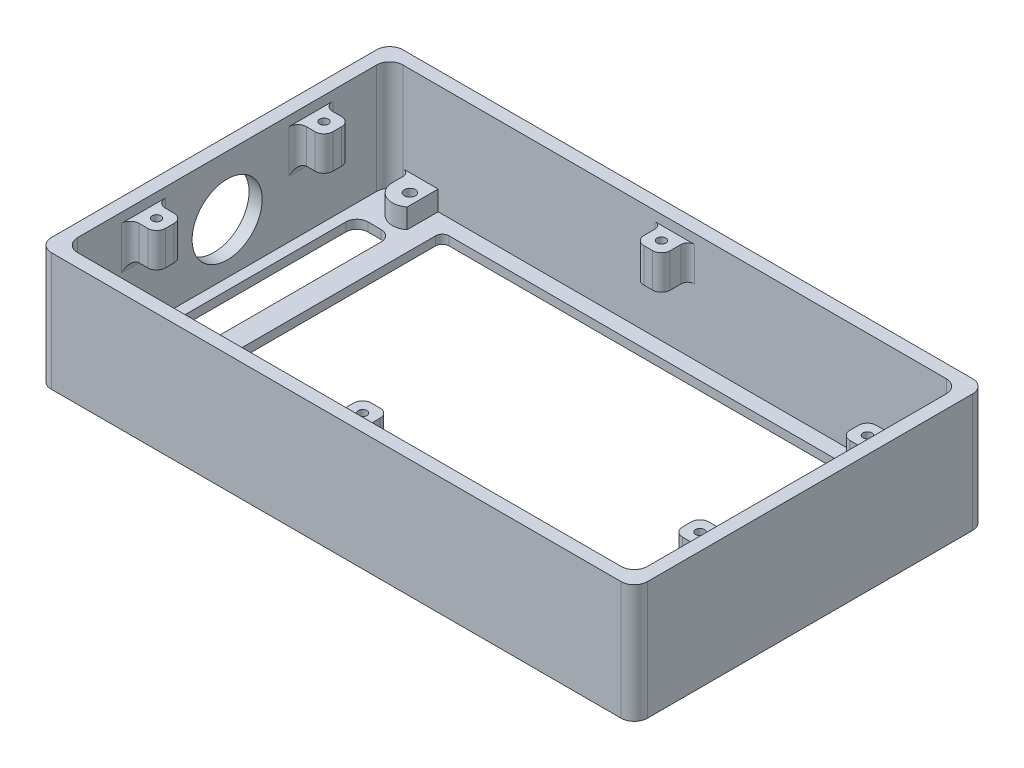
from build123d import *

# Parameters (mm, degrees)
BOSS_EXTRUDE2_DEPTH            = 2
SKETCH3_R                      = 1
SKETCH3_W                      = 99
SKETCH3_H                      = 58
CUT_EXTRUDE1_DEPTH             = 2
SKETCH5_R                      = 4
SKETCH5_R_2                    = 1.25
BOSS_EXTRUDE4_DEPTH            = 4.5
BOSS_EXTRUDE5_DEPTH            = 25
BOSS_EXTRUDE6_START            = -2
SKETCH7_R                      = 1
BOSS_EXTRUDE6_DEPTH            = 2
BOSS_EXTRUDE8_DEPTH            = 10
CUT_EXTRUDE2_START             = -2.2
CUT_EXTRUDE2_DEPTH             = 2.2
FILLET2_R                      = 1.5
FILLET3_R                      = 2
BOSS_EXTRUDE11_START           = -4.5
BOSS_EXTRUDE11_DEPTH           = 4.5
BOSS_EXTRUDE12_START           = -4.5
BOSS_EXTRUDE12_DEPTH           = 4.5
CUT_EXTRUDE3_REACH             = 160.697
SKETCH16_R                     = 8
CUT_EXTRUDE3_DIRECTION_2_DEPTH = 159.697321969
SKETCH17_R                     = 1
BOSS_EXTRUDE14_DEPTH           = 10
SKETCH20_R                     = 1
BOSS_EXTRUDE15_DEPTH           = 10
FILLET6_R                      = 1.5
SKETCH22_W                     = 21.854456245
SKETCH22_H                     = 74.2
CUT_EXTRUDE4_DEPTH             = 2.2
CUT_EXTRUDE5_DEPTH             = 156.800641847
SKETCH28_W                     = 3.653632657
SKETCH28_H                     = 8
SKETCH28_H_2                   = 9.504640586
CUT_EXTRUDE6_DEPTH             = 4.5


with BuildPart() as part:
    # Sketch2 → Boss-Extrude2 (new body)
    with BuildSketch(Plane(origin=(0, 0, 0), x_dir=(1, 0, 0), z_dir=(0, 1, 0))):
        with BuildLine():
            Line((0, 77.2), (130, 77.2))
            ThreePointArc((130, 77.2), (132.121320344, 76.321320344), (133, 74.2))
            Line((133, 74.2), (133, 0))
            ThreePointArc((133, 0), (132.121320344, -2.121320344), (130, -3))
            Line((130, -3), (0, -3))
            ThreePointArc((0, -3), (-2.121320344, -2.121320344), (-3, 0))
            Line((-3, 0), (-3, 74.2))
            ThreePointArc((-3, 74.2), (-2.121320344, 76.321320344), (0, 77.2))
        make_face()
    extrude(amount=BOSS_EXTRUDE2_DEPTH)

    # Sketch3 → Cut-Extrude1 (cut)
    with BuildSketch(Plane(origin=(0, 2, 0), x_dir=(1, 0, 0), z_dir=(0, 1, 0))):
        with Locations(Location((8.55, 70.25, 0), (0, 0, 270))):
            Circle(SKETCH3_R)
        with Locations(Location((8.55, 8.15, 0), (0, 0, 270))):
            Circle(SKETCH3_R)
        with Locations(Location((121.15, 8.15, 0), (0, 0, 270))):
            Circle(SKETCH3_R)
        with Locations(Location((121.15, 70.25, 0), (0, 0, 270))):
            Circle(SKETCH3_R)
        with Locations((65, 41.7)):
            Rectangle(SKETCH3_W, SKETCH3_H)
    extrude(amount=-CUT_EXTRUDE1_DEPTH, mode=Mode.SUBTRACT)

    # Sketch5 → Boss-Extrude4 (add)
    # profile 1 of 4: a face of its own
    with BuildSketch(Plane(origin=(0, 2, 0), x_dir=(1, 0, 0), z_dir=(0, 1, 0))):
        with Locations(Location((8.55, 70.25, 0), (0, 0, 270))):
            Circle(SKETCH5_R)
        with Locations(Location((8.55, 70.25, 0), (0, 0, 270))):
            Circle(SKETCH5_R_2, mode=Mode.SUBTRACT)
    # profile 2 of 4: a face of its own
    with BuildSketch(Plane(origin=(0, 2, 0), x_dir=(1, 0, 0), z_dir=(0, 1, 0))):
        with Locations(Location((8.55, 8.15, 0), (0, 0, 270))):
            Circle(SKETCH5_R)
        with Locations(Location((8.55, 8.15, 0), (0, 0, 270))):
            Circle(SKETCH5_R_2, mode=Mode.SUBTRACT)
    # profile 3 of 4: a face of its own
    with BuildSketch(Plane(origin=(0, 2, 0), x_dir=(1, 0, 0), z_dir=(0, 1, 0))):
        with Locations(Location((121.15, 8.15, 0), (0, 0, 270))):
            Circle(SKETCH5_R)
        with Locations(Location((121.15, 8.15, 0), (0, 0, 270))):
            Circle(SKETCH5_R_2, mode=Mode.SUBTRACT)
    # profile 4 of 4: a face of its own
    with BuildSketch(Plane(origin=(0, 2, 0), x_dir=(1, 0, 0), z_dir=(0, 1, 0))):
        with Locations(Location((121.15, 70.25, 0), (0, 0, 270))):
            Circle(SKETCH5_R)
        with Locations(Location((121.15, 70.25, 0), (0, 0, 270))):
            Circle(SKETCH5_R_2, mode=Mode.SUBTRACT)
    extrude(amount=BOSS_EXTRUDE4_DEPTH)

    # Sketch6 → Boss-Extrude5 (add)
    with BuildSketch(Plane(origin=(0, 2, 0), x_dir=(1, 0, 0), z_dir=(0, 1, 0))):
        with BuildLine():
            Line((0, 77.2), (130, 77.2))
            ThreePointArc((130, 77.2), (132.121320344, 76.321320344), (133, 74.2))
            Line((133, 74.2), (133, 0))
            ThreePointArc((133, 0), (132.121320344, -2.121320344), (130, -3))
            Line((130, -3), (0, -3))
            ThreePointArc((0, -3), (-2.121320344, -2.121320344), (-3, 0))
            Line((-3, 0), (-3, 74.2))
            ThreePointArc((-3, 74.2), (-2.121320344, 76.321320344), (0, 77.2))
        make_face()
        with BuildLine():
            Line((3, 74.2), (127, 74.2))
            ThreePointArc((127, 74.2), (129.121320344, 73.321320344), (130, 71.2))
            Line((130, 71.2), (130, 3))
            ThreePointArc((130, 3), (129.121320344, 0.878679656), (127, 0))
            Line((127, 0), (3, 0))
            ThreePointArc((3, 0), (0.878679656, 0.878679656), (0, 3))
            Line((0, 3), (0, 71.2))
            ThreePointArc((0, 71.2), (0.878679656, 73.321320344), (3, 74.2))
        make_face(mode=Mode.SUBTRACT)
    extrude(amount=BOSS_EXTRUDE5_DEPTH)

    # Sketch7 → Boss-Extrude6 (add)
    with BuildSketch(Plane.XZ.offset(BOSS_EXTRUDE6_START)):
        with Locations((8.55, -8.15)):
            Circle(SKETCH7_R)
        with Locations((8.55, -70.25)):
            Circle(SKETCH7_R)
        with Locations((121.15, -70.25)):
            Circle(SKETCH7_R)
        with Locations((121.15, -8.15)):
            Circle(SKETCH7_R)
    extrude(amount=BOSS_EXTRUDE6_DEPTH)

    # Sketch10 → Boss-Extrude8 (add)
    with BuildSketch(Plane(origin=(0, 27, 0), x_dir=(1, 0, 0), z_dir=(0, 1, 0))):
        with BuildLine():
            Line((4, 59.2), (0, 59.2))
            Line((0, 59.2), (2.292893219, 56.907106781))
            ThreePointArc((2.292893219, 56.907106781), (3.382683432, 57.123879533), (4, 56.2))
            ThreePointArc((4, 56.2), (3.923879533, 55.817316568), (3.707106781, 55.492893219))
            Line((3.707106781, 55.492893219), (5.414213562, 53.785786438))
            ThreePointArc((5.414213562, 53.785786438), (5.847759065, 54.434633135), (6, 55.2))
            Line((6, 55.2), (6, 57.2))
            ThreePointArc((6, 57.2), (5.414213562, 58.614213562), (4, 59.2))
        make_face()
        with BuildLine():
            Line((2.292893219, 56.907106781), (0, 59.2))
            Line((0, 59.2), (0, 53.2))
            Line((0, 53.2), (4, 53.2))
            ThreePointArc((4, 53.2), (4.765366865, 53.352240935), (5.414213562, 53.785786438))
            Line((5.414213562, 53.785786438), (3.707106781, 55.492893219))
            ThreePointArc((3.707106781, 55.492893219), (2.292893219, 55.492893219), (2.292893219, 56.907106781))
        make_face()
        with BuildLine():
            Line((2.292893219, 18.707106781), (0, 21))
            Line((0, 21), (0, 15))
            Line((0, 15), (4, 15))
            ThreePointArc((4, 15), (4.765366865, 15.152240935), (5.414213562, 15.585786438))
            Line((5.414213562, 15.585786438), (3.707106781, 17.292893219))
            ThreePointArc((3.707106781, 17.292893219), (2.292893219, 17.292893219), (2.292893219, 18.707106781))
        make_face()
        with BuildLine():
            Line((4, 21), (0, 21))
            Line((0, 21), (2.292893219, 18.707106781))
            ThreePointArc((2.292893219, 18.707106781), (3.382683432, 18.923879533), (4, 18))
            ThreePointArc((4, 18), (3.923879533, 17.617316568), (3.707106781, 17.292893219))
            Line((3.707106781, 17.292893219), (5.414213562, 15.585786438))
            ThreePointArc((5.414213562, 15.585786438), (5.847759065, 16.234633135), (6, 17))
            Line((6, 17), (6, 19))
            ThreePointArc((6, 19), (5.414213562, 20.414213562), (4, 21))
        make_face()
        with BuildLine():
            Line((130, 53.2), (130, 59.2))
            Line((130, 59.2), (127.707106781, 56.907106781))
            ThreePointArc((127.707106781, 56.907106781), (127.923879533, 56.582683432), (128, 56.2))
            ThreePointArc((128, 56.2), (127.382683432, 55.276120467), (126.292893219, 55.492893219))
            Line((126.292893219, 55.492893219), (124.585786438, 53.785786438))
            ThreePointArc((124.585786438, 53.785786438), (125.234633135, 53.352240935), (126, 53.2))
            Line((126, 53.2), (130, 53.2))
        make_face()
        with BuildLine():
            Line((127.707106781, 56.907106781), (130, 59.2))
            Line((130, 59.2), (126, 59.2))
            ThreePointArc((126, 59.2), (124.585786438, 58.614213562), (124, 57.2))
            Line((124, 57.2), (124, 55.2))
            ThreePointArc((124, 55.2), (124.152240935, 54.434633135), (124.585786438, 53.785786438))
            Line((124.585786438, 53.785786438), (126.292893219, 55.492893219))
            ThreePointArc((126.292893219, 55.492893219), (126.292893219, 56.907106781), (127.707106781, 56.907106781))
        make_face()
        with BuildLine():
            Line((130, 15), (130, 21))
            Line((130, 21), (127.707106781, 18.707106781))
            ThreePointArc((127.707106781, 18.707106781), (127.923879533, 18.382683432), (128, 18))
            ThreePointArc((128, 18), (127.382683432, 17.076120467), (126.292893219, 17.292893219))
            Line((126.292893219, 17.292893219), (124.585786438, 15.585786438))
            ThreePointArc((124.585786438, 15.585786438), (125.234633135, 15.152240935), (126, 15))
            Line((126, 15), (130, 15))
        make_face()
        with BuildLine():
            Line((127.707106781, 18.707106781), (130, 21))
            Line((130, 21), (126, 21))
            ThreePointArc((126, 21), (124.585786438, 20.414213562), (124, 19))
            Line((124, 19), (124, 17))
            ThreePointArc((124, 17), (124.152240935, 16.234633135), (124.585786438, 15.585786438))
            Line((124.585786438, 15.585786438), (126.292893219, 17.292893219))
            ThreePointArc((126.292893219, 17.292893219), (126.292893219, 18.707106781), (127.707106781, 18.707106781))
        make_face()
    extrude(amount=-BOSS_EXTRUDE8_DEPTH)

    # Sketch11 → Cut-Extrude2 (cut)
    with BuildSketch(Plane(origin=(0, 27, 0), x_dir=(1, 0, 0), z_dir=(0, 1, 0)).offset(CUT_EXTRUDE2_START)):
        with BuildLine():
            Line((3, 74.2), (127, 74.2))
            ThreePointArc((127, 74.2), (129.121320344, 73.321320344), (130, 71.2))
            Line((130, 71.2), (130, 3))
            ThreePointArc((130, 3), (129.121320344, 0.878679656), (127, 0))
            Line((127, 0), (3, 0))
            ThreePointArc((3, 0), (0.878679656, 0.878679656), (0, 3))
            Line((0, 3), (0, 71.2))
            ThreePointArc((0, 71.2), (0.878679656, 73.321320344), (3, 74.2))
        make_face()
    extrude(amount=CUT_EXTRUDE2_DEPTH, mode=Mode.SUBTRACT)

    # Fillet2
    fillet2_edges = [part.edges().sort_by_distance(p)[0] for p in [
        (15.5, 1, -70.7),
        (114.5, 1, -70.7),
        (114.5, 1, -12.7),
        (15.5, 1, -12.7),
    ]]
    fillet(fillet2_edges, radius=FILLET2_R)

    # Fillet3
    fillet3_edges = [part.edges().sort_by_distance(p)[0] for p in [
        (0, 20.9, -53.2),
        (0, 20.9, -59.2),
        (0, 17, -56.2),
        (0, 20.9, -21),
        (0, 20.9, -15),
        (0, 17, -18),
        (130, 20.9, -59.2),
        (130, 20.9, -53.2),
        (130, 17, -56.2),
        (130, 20.9, -21),
        (130, 20.9, -15),
        (130, 17, -18),
    ]]
    fillet(fillet3_edges, radius=FILLET3_R - 0.0001)  # a hair under: the kernel refuses the full size

    # Sketch14 → Boss-Extrude11 (add)
    with BuildSketch(Plane(origin=(0, 6.5, 0), x_dir=(1, 0, 0), z_dir=(0, 1, 0)).offset(BOSS_EXTRUDE11_START)):
        with BuildLine():
            Line((4.55, 74.2), (4.55, 70.25))
            ThreePointArc((4.55, 70.25), (5.506818766, 72.845967638), (7.919523989, 74.2))
            Line((7.919523989, 74.2), (4.55, 74.2))
        make_face()
        with BuildLine():
            ThreePointArc((9.180476011, 74.2), (11.593181234, 72.845967638), (12.55, 70.25))
            Line((12.55, 70.25), (12.55, 74.2))
            Line((12.55, 74.2), (9.180476011, 74.2))
        make_face()
    extrude(amount=BOSS_EXTRUDE11_DEPTH)

    # Sketch15 → Boss-Extrude12 (add)
    with BuildSketch(Plane(origin=(0, 6.5, 0), x_dir=(1, 0, 0), z_dir=(0, 1, 0)).offset(BOSS_EXTRUDE12_START)):
        with BuildLine():
            Line((117.15, 74.2), (117.15, 70.25))
            ThreePointArc((117.15, 70.25), (118.106818766, 72.845967638), (120.519523989, 74.2))
            Line((120.519523989, 74.2), (117.15, 74.2))
        make_face()
        with BuildLine():
            ThreePointArc((121.780476011, 74.2), (124.193181234, 72.845967638), (125.15, 70.25))
            Line((125.15, 70.25), (125.15, 74.2))
            Line((125.15, 74.2), (121.780476011, 74.2))
        make_face()
    extrude(amount=BOSS_EXTRUDE12_DEPTH)

    # Sketch16 → Cut-Extrude3 (cut, up to next)
    with BuildSketch(Plane.ZY.offset(3), mode=Mode.PRIVATE) as cut_extrude3_sk1:
        with Locations(Location((-37.1, 13.5, 0), (0, 0, 180))):
            Circle(SKETCH16_R)
    cut_extrude3_tool1 = extrude(cut_extrude3_sk1.sketch, amount=-CUT_EXTRUDE3_REACH, mode=Mode.PRIVATE) & part.part
    add(cut_extrude3_tool1.solids().sort_by_distance((-3, 13.5, -37.1))[0], mode=Mode.SUBTRACT)

    # Sketch16 → Cut-Extrude3 direction 2 (cut)
    with BuildSketch(Plane.ZY.offset(3)):
        with Locations(Location((-37.1, 13.5, 0), (0, 0, 180))):
            Circle(SKETCH16_R)
    extrude(amount=CUT_EXTRUDE3_DIRECTION_2_DEPTH, mode=Mode.SUBTRACT)

    # Sketch17 → Boss-Extrude14 (add)
    with BuildSketch(Plane(origin=(0, 27, 0), x_dir=(1, 0, 0), z_dir=(0, 1, 0))):
        with BuildLine():
            Line((62, 74.2), (68, 74.2))
            Line((68, 74.2), (68, 70.2))
            ThreePointArc((68, 70.2), (67.414213562, 68.785786438), (66, 68.2))
            Line((66, 68.2), (64, 68.2))
            ThreePointArc((64, 68.2), (62.585786438, 68.785786438), (62, 70.2))
            Line((62, 70.2), (62, 74.2))
        make_face()
        with Locations(Location((65, 71.2, 0), (0, 0, 270))):
            Circle(SKETCH17_R, mode=Mode.SUBTRACT)
    extrude(amount=-BOSS_EXTRUDE14_DEPTH)

    # Sketch20 → Boss-Extrude15 (add)
    with BuildSketch(Plane(origin=(0, 27, 0), x_dir=(1, 0, 0), z_dir=(0, 1, 0))):
        with BuildLine():
            Line((62, 0), (68, 0))
            Line((68, 0), (68, 4))
            ThreePointArc((68, 4), (67.414213562, 5.414213562), (66, 6))
            Line((66, 6), (64, 6))
            ThreePointArc((64, 6), (62.585786438, 5.414213562), (62, 4))
            Line((62, 4), (62, 0))
        make_face()
        with Locations(Location((65, 3, 0), (0, 0, 270))):
            Circle(SKETCH20_R, mode=Mode.SUBTRACT)
    extrude(amount=-BOSS_EXTRUDE15_DEPTH)

    # Fillet6
    fillet6_edges = [part.edges().sort_by_distance(p)[0] for p in [
        (4.55, 4.25, -74.2),
        (12.55, 4.25, -74.2),
        (117.15, 4.25, -74.2),
        (125.15, 4.25, -74.2),
        (62, 22, -74.2),
        (68, 22, -74.2),
        (62, 22, 0),
        (68, 22, 0),
    ]]
    fillet(fillet6_edges, radius=FILLET6_R)

    # Sketch22 → Cut-Extrude4 (cut)
    with BuildSketch(Plane(origin=(0, 27, 0), x_dir=(1, 0, 0), z_dir=(0, 1, 0))):
        with Locations((65.381182377, 37.1)):
            Rectangle(SKETCH22_W, SKETCH22_H)
    extrude(amount=-CUT_EXTRUDE4_DEPTH, mode=Mode.SUBTRACT)

    # Sketch27 → Cut-Extrude5 (cut, through all)
    with BuildSketch(Plane(origin=(0, 2, 0), x_dir=(1, 0, 0), z_dir=(0, 1, 0))):
        with BuildLine():
            Line((5, 64.2), (8, 64.2))
            ThreePointArc((8, 64.2), (9.767766953, 63.467766953), (10.5, 61.7))
            Line((10.5, 61.7), (10.5, 16.7))
            ThreePointArc((10.5, 16.7), (9.767766953, 14.932233047), (8, 14.2))
            Line((8, 14.2), (5, 14.2))
            ThreePointArc((5, 14.2), (3.232233047, 14.932233047), (2.5, 16.7))
            Line((2.5, 16.7), (2.5, 61.7))
            ThreePointArc((2.5, 61.7), (3.232233047, 63.467766953), (5, 64.2))
        make_face()
        with BuildLine():
            Line((119.5, 61.7), (119.5, 16.7))
            ThreePointArc((119.5, 16.7), (120.232233047, 14.932233047), (122, 14.2))
            Line((122, 14.2), (125, 14.2))
            ThreePointArc((125, 14.2), (126.767766953, 14.932233047), (127.5, 16.7))
            Line((127.5, 16.7), (127.5, 61.7))
            ThreePointArc((127.5, 61.7), (126.767766953, 63.467766953), (125, 64.2))
            Line((125, 64.2), (122, 64.2))
            ThreePointArc((122, 64.2), (120.232233047, 63.467766953), (119.5, 61.7))
        make_face()
    extrude(amount=-CUT_EXTRUDE5_DEPTH, mode=Mode.SUBTRACT)

    # Sketch28 → Cut-Extrude6 (cut)
    with BuildSketch(Plane(origin=(0, 2, 0), x_dir=(1, 0, 0), z_dir=(0, 1, 0))):
        with Locations((12.876816329, 70.2)):
            Rectangle(SKETCH28_W, SKETCH28_H)
        with Locations((12.876816329, 8.394297438)):
            Rectangle(SKETCH28_W, SKETCH28_H_2)
        with Locations((117.123183672, 8.394297438)):
            Rectangle(SKETCH28_W, SKETCH28_H_2)
        with Locations((117.123183672, 70.2)):
            Rectangle(SKETCH28_W, SKETCH28_H)
    extrude(amount=CUT_EXTRUDE6_DEPTH, mode=Mode.SUBTRACT)


solid = part.part
